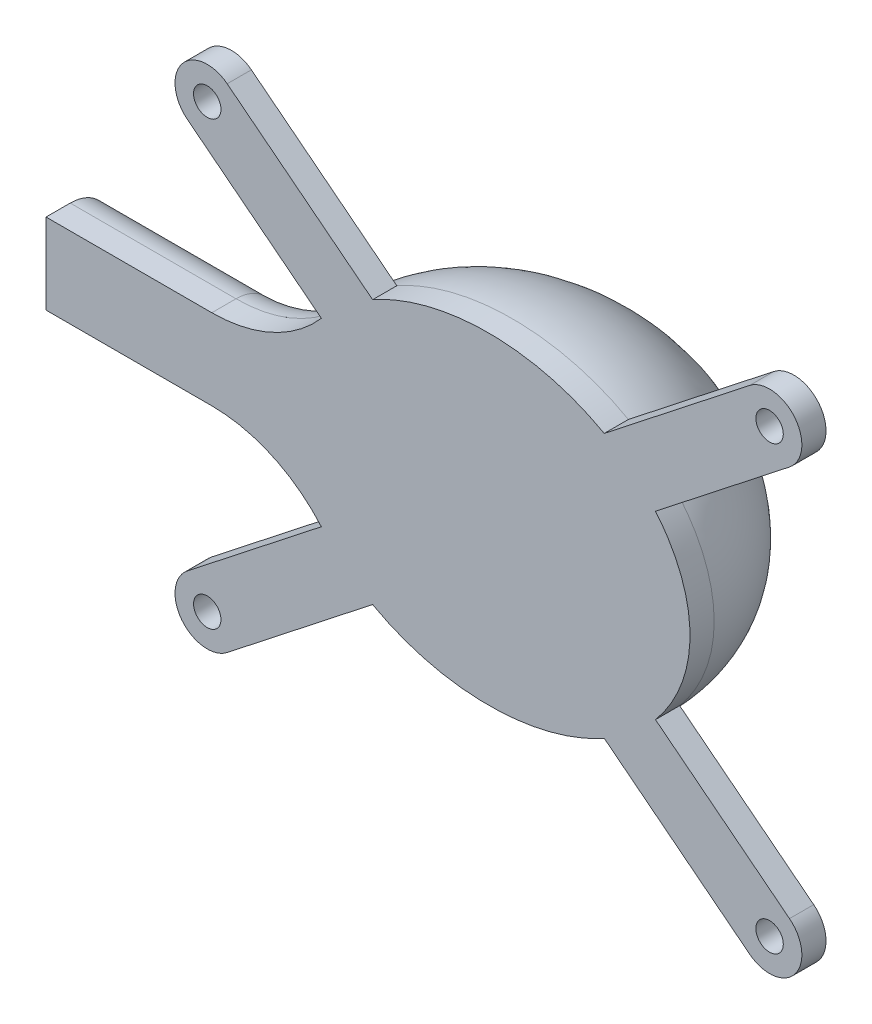
from build123d import *

# Parameters (mm, degrees)
R_VOLUTION2_ANGLE  = 180
R_VOLUTION4_START  = -54.865727699
R_VOLUTION4_DEPTH  = 30.659581785
CONG_1_R           = 18
ESQUISSE4_R        = 1.7
BOSS_EXTRU_3_DEPTH = 3
BOSS_EXTRU_4_DEPTH = 3
ESQUISSE6_RX       = 25
ESQUISSE6_RY       = 20
BOSS_EXTRU_5_DEPTH = 3
ESQUISSE8_W        = 41.684690815
ESQUISSE8_H        = 10
BOSS_EXTRU_6_DEPTH = 3
CONG_2_R           = 18
CONG_3_R           = 18


# Read off the part's stored shape, not the designer's step: Révolution4
with BuildPart() as part:
    # Esquisse1 → Révolution2 (revolve)
    with BuildSketch(Plane.XY):
        with BuildLine():
            Line((25, 0), (-25, 0))
            add(Edge.make_bspline(
                [(25, 0), (25, 20), (0, 20), (-25, 20), (-25, 0)],
                knots=[3.141592654, 3.141592654, 3.141592654, 4.71238898, 4.71238898, 6.283185307, 6.283185307, 6.283185307], degree=2, weights=[1, 0.707106781, 1, 0.707106781, 1]))
        make_face()
    revolve(axis=Axis((25, 0, 0), (-1, 0, 0)), revolution_arc=R_VOLUTION2_ANGLE)

    # Révolution4 outline → Révolution4 (add)
    with BuildSketch(Plane.YZ.offset(R_VOLUTION4_START)):
        with BuildLine():
            Line((5, 0), (-5, 0))
            ThreePointArc((-5, 0), (0, -5), (5, 0))
        make_face()
    extrude(amount=R_VOLUTION4_DEPTH)

    # Congé1
    cong_1_edges = [part.edges().sort_by_distance(p)[0] for p in [
        (-24.206145914, 0, -5),
    ]]
    fillet(cong_1_edges, radius=CONG_1_R)

    # Esquisse4 → Boss.-Extru.3 (add)
    with BuildSketch(Plane.XY):
        with BuildLine():
            Line((-32.398768241, 30.54317328), (0, 5.086998233))
            Line((0, 5.086998233), (32.398768241, 30.54317328))
            ThreePointArc((32.398768241, 30.54317328), (38.015327804, 29.869186132), (37.341340657, 24.252626569))
            Line((37.341340657, 24.252626569), (6.474361387, 0))
            Line((6.474361387, 0), (37.341340657, -24.252626569))
            ThreePointArc((37.341340657, -24.252626569), (38.015327804, -29.869186132), (32.398768241, -30.54317328))
            Line((32.398768241, -30.54317328), (0, -5.086998233))
            Line((0, -5.086998233), (-32.398768241, -30.54317328))
            ThreePointArc((-32.398768241, -30.54317328), (-38.015327804, -29.869186132), (-37.341340657, -24.252626569))
            Line((-37.341340657, -24.252626569), (-6.474361387, 0))
            Line((-6.474361387, 0), (-37.341340657, 24.252626569))
            ThreePointArc((-37.341340657, 24.252626569), (-38.015327804, 29.869186132), (-32.398768241, 30.54317328))
        make_face()
        with Locations((34.870054449, 27.397899924)):
            Circle(ESQUISSE4_R, mode=Mode.SUBTRACT)
        with Locations((34.870054449, -27.397899924)):
            Circle(ESQUISSE4_R, mode=Mode.SUBTRACT)
        with Locations((-34.870054449, 27.397899924)):
            Circle(ESQUISSE4_R, mode=Mode.SUBTRACT)
        with Locations((-34.870054449, -27.397899924)):
            Circle(ESQUISSE4_R, mode=Mode.SUBTRACT)
    extrude(amount=BOSS_EXTRU_3_DEPTH)

    # Esquisse1<2> → Boss.-Extru.4 (add)
    with BuildSketch(Plane.XY):
        with BuildLine():
            Line((25, 0), (-25, 0))
            add(Edge.make_bspline(
                [(25, 0), (25, 20), (0, 20), (-25, 20), (-25, 0)],
                knots=[3.141592654, 3.141592654, 3.141592654, 4.71238898, 4.71238898, 6.283185307, 6.283185307, 6.283185307], degree=2, weights=[1, 0.707106781, 1, 0.707106781, 1]))
        make_face()
    extrude(amount=BOSS_EXTRU_4_DEPTH)

    # Esquisse6 → Boss.-Extru.5 (add)
    with BuildSketch(Plane.XY.offset(3)):
        with Locations((0, 0)):
            Ellipse(ESQUISSE6_RX, ESQUISSE6_RY)
    extrude(amount=-BOSS_EXTRU_5_DEPTH)

    # Esquisse8 → Boss.-Extru.6 (add)
    with BuildSketch(Plane.XY):
        with Locations((-34.023382291, 0)):
            Rectangle(ESQUISSE8_W, ESQUISSE8_H)
    extrude(amount=BOSS_EXTRU_6_DEPTH)

    # Congé2
    # the kernel refuses this fillet: 18 mm, written as the material it adds along each edge
    with BuildSketch(Plane(origin=(-24.206145914, -5, 0), x_dir=(-1, 0, 0), z_dir=(0, 0, 1))) as cong_2_piece_1:
        with BuildLine():
            CenterArc((10.09862512, 18), CONG_2_R, 220.994829653, 49.005170347)
            Line((-3.487212913, 6.19216341), (-3.758929674, 5.956006679))
            ThreePointArc((-3.758929674, 5.956006679), (-1.755079895, 3.089571084), (-0.342598285, -0.110573121))
            Line((-0.342598285, -0.110573121), (0, -0.36))
            Line((0, -0.36), (10.09862512, -0.36))
            Line((10.09862512, -0.36), (10.09862512, 0))
        make_face()
    extrude(amount=3)

    # Congé3
    # the kernel refuses this fillet: 18 mm, written as the material it adds along each edge
    with BuildSketch(Plane(origin=(-24.206145914, 5, 3), x_dir=(-1, 0, 0), z_dir=(0, 0, -1))) as cong_3_piece_1:
        with BuildLine():
            CenterArc((10.09862512, 18), CONG_3_R, 220.994829653, 49.005170347)
            Line((-3.487212913, 6.19216341), (-3.758929674, 5.956006679))
            ThreePointArc((-3.758929674, 5.956006679), (-1.755079895, 3.089571084), (-0.342598285, -0.110573121))
            Line((-0.342598285, -0.110573121), (0, -0.36))
            Line((0, -0.36), (10.09862512, -0.36))
            Line((10.09862512, -0.36), (10.09862512, 0))
        make_face()
    extrude(amount=3)


solid = part.part
